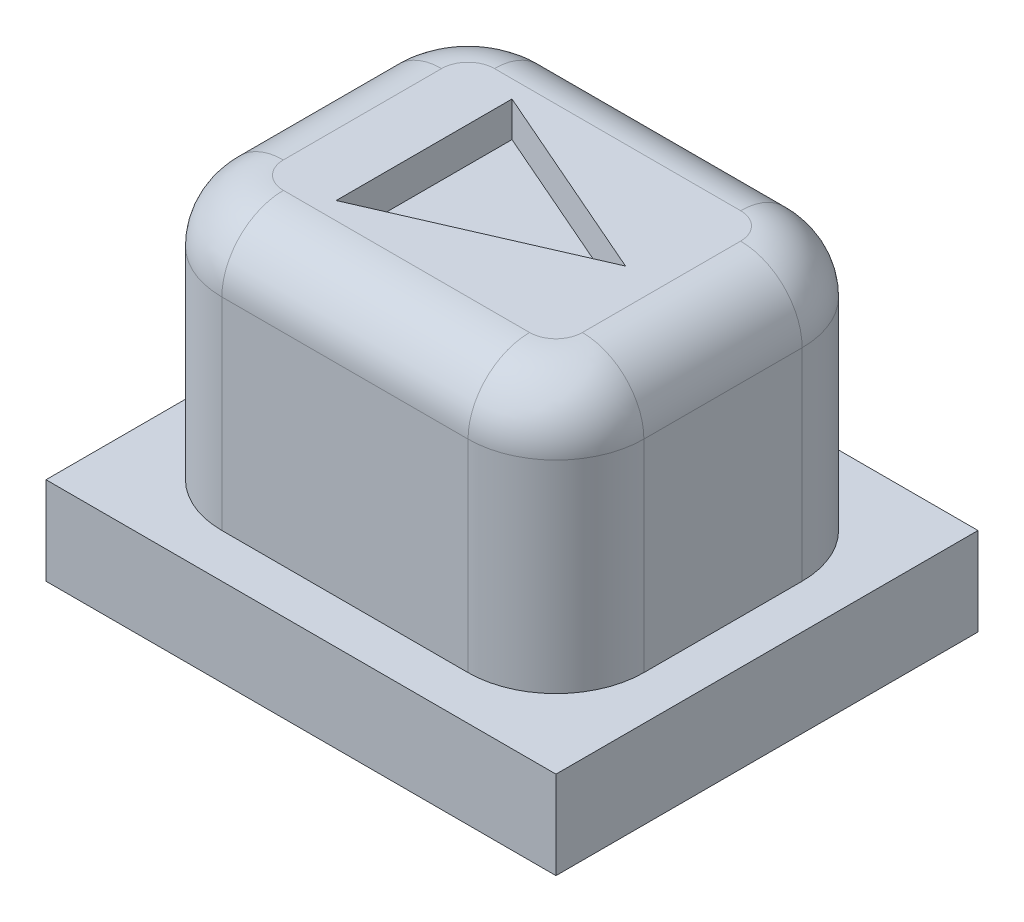
from build123d import *

# Parameters (mm, degrees)
EXTRUDE_297_DEPTH      = 3
SKETCH_2_W             = 5.8
SKETCH_2_H             = 4.8
EXTRUDE_531_DEPTH      = 1
CUT_EXTRUDE_771_DEPTH  = 1
CUT_EXTRUDE_1013_DEPTH = 0.4
FILLET_1_R             = 0.7


with BuildPart() as part:
    # 草图1 → Extrude 297 (new body)
    with BuildSketch(Plane(origin=(0, 0, 0), x_dir=(1, 0, 0), z_dir=(0, 1, 0))):
        with BuildLine():
            Line((-1.4, -1.9), (1.4, -1.9))
            ThreePointArc((1.4, -1.9), (2.107106781, -1.607106781), (2.4, -0.9))
            Line((2.4, -0.9), (2.4, 0.9))
            ThreePointArc((2.4, 0.9), (2.107106781, 1.607106781), (1.4, 1.9))
            Line((1.4, 1.9), (-1.4, 1.9))
            ThreePointArc((-1.4, 1.9), (-2.107106781, 1.607106781), (-2.4, 0.9))
            Line((-2.4, 0.9), (-2.4, -0.9))
            ThreePointArc((-2.4, -0.9), (-2.107106781, -1.607106781), (-1.4, -1.9))
        make_face()
    extrude(amount=EXTRUDE_297_DEPTH)

    # 草图2 → Extrude 531 (add)
    with BuildSketch(Plane.XZ):
        Rectangle(SKETCH_2_W, SKETCH_2_H)
    extrude(amount=EXTRUDE_531_DEPTH)

    # 草图3 → Cut-Extrude 771 (cut)
    with BuildSketch(Plane.XZ.offset(1)):
        with BuildLine():
            Line((-0.75, -1.25), (0.75, -1.25))
            ThreePointArc((0.75, -1.25), (1.457106781, -0.957106781), (1.75, -0.25))
            Line((1.75, -0.25), (1.75, 0.25))
            ThreePointArc((1.75, 0.25), (1.457106781, 0.957106781), (0.75, 1.25))
            Line((0.75, 1.25), (-0.75, 1.25))
            ThreePointArc((-0.75, 1.25), (-1.457106781, 0.957106781), (-1.75, 0.25))
            Line((-1.75, 0.25), (-1.75, -0.25))
            ThreePointArc((-1.75, -0.25), (-1.457106781, -0.957106781), (-0.75, -1.25))
        make_face()
    extrude(amount=-CUT_EXTRUDE_771_DEPTH, mode=Mode.SUBTRACT)

    # 草图4 → Cut-Extrude 1013 (cut)
    with BuildSketch(Plane(origin=(0, 3, 0), x_dir=(1, 0, 0), z_dir=(0, 1, 0))):
        Polygon((-1, 1), (-1, -1), (1.291287847, 0), align=None)
    extrude(amount=-CUT_EXTRUDE_1013_DEPTH, mode=Mode.SUBTRACT)

    # 圆角1
    fillet_1_edges = [part.edges().sort_by_distance(p)[0] for p in [
        (2.107106781, 3, -1.607106781),
        (2.4, 3, 0),
        (2.107106781, 3, 1.607106781),
        (0, 3, 1.9),
        (-2.107106781, 3, 1.607106781),
        (-2.4, 3, 0),
        (-2.107106781, 3, -1.607106781),
        (0, 3, -1.9),
    ]]
    fillet(fillet_1_edges, radius=FILLET_1_R)


solid = part.part
